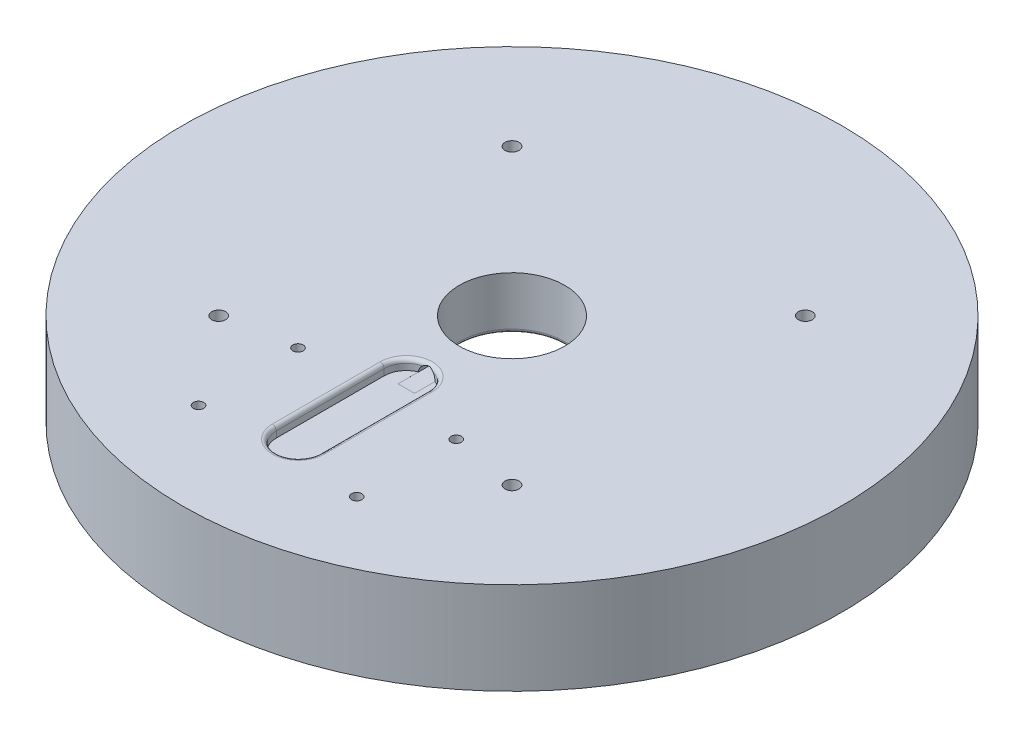
from build123d import *

# Parameters (mm, degrees)
SKETCH1_R               = 154.305
BOSS_EXTRUDE1_DEPTH     = 25.4
SKETCH3_R               = 3.37312
CUT_EXTRUDE1_DEPTH      = 276.403891776
SKETCH5_R               = 25.4
CUT_EXTRUDE2_DEPTH      = 276.403891776
SKETCH6_W               = 159.004
SKETCH6_H               = 159.004
CUT_EXTRUDE3_DEPTH      = 19.05
BOSS_EXTRUDE2_START     = -19.05
SKETCH7_R               = 158.75
SKETCH7_R_2             = 154.305
BOSS_EXTRUDE2_DEPTH     = 44.45
CUT_EXTRUDE4_DEPTH      = 4.9276
CUT_EXTRUDE8_REACH      = 266.23
CUT_EXTRUDE8_END_RADIUS = 25.4
SKETCH11_R              = 2.499995
CUT_EXTRUDE9_DEPTH      = 8.0000094
BOSS_EXTRUDE3_START     = 19.05
SKETCH12_R              = 29.21
SKETCH12_R_2            = 25.4
BOSS_EXTRUDE3_DEPTH     = 19.05
FILLET1_R               = 1.905


with BuildPart() as part:
    # Sketch1 → Boss-Extrude1 (new body)
    with BuildSketch(Plane(origin=(0, 0, 0), x_dir=(1, 0, 0), z_dir=(0, 1, 0))):
        with Locations(Location((0, 0, 0), (0, 0, 270))):
            Circle(SKETCH1_R)
    extrude(amount=BOSS_EXTRUDE1_DEPTH)

    # Sketch3 → Cut-Extrude1 (cut, through all)
    with BuildSketch(Plane(origin=(3.2638069, 0, 70.137007426), x_dir=(-1, 0, 0), z_dir=(0, -1, 0))):
        with Locations(Location((-67.3799431, 140.780757426, 0), (0, 0, 90))):
            Circle(SKETCH3_R)
        with Locations(Location((73.9075569, 140.780757426, 0), (0, 0, 90))):
            Circle(SKETCH3_R)
        with Locations(Location((73.9075569, -0.506742574, 0), (0, 0, 90))):
            Circle(SKETCH3_R)
        with Locations(Location((-67.3799431, -0.506742574, 0), (0, 0, 90))):
            Circle(SKETCH3_R)
    extrude(amount=-CUT_EXTRUDE1_DEPTH, mode=Mode.SUBTRACT)

    # Sketch5 → Cut-Extrude2 (cut, through all)
    with BuildSketch(Plane(origin=(3.2638069, 0, 70.137007426), x_dir=(-1, 0, 0), z_dir=(0, -1, 0))):
        with Locations(Location((3.2638069, 70.137007426, 0), (0, 0, 90))):
            Circle(SKETCH5_R)
    extrude(amount=-CUT_EXTRUDE2_DEPTH, mode=Mode.SUBTRACT)

    # Sketch6 → Cut-Extrude3 (cut)
    with BuildSketch(Plane.XZ):
        Rectangle(SKETCH6_W, SKETCH6_H)
    extrude(amount=-CUT_EXTRUDE3_DEPTH, mode=Mode.SUBTRACT)

    # Sketch7 → Boss-Extrude2 (add)
    with BuildSketch(Plane(origin=(0, 0, 0), x_dir=(1, 0, 0), z_dir=(0, 1, 0)).offset(BOSS_EXTRUDE2_START)):
        with Locations(Location((0, 0, 0), (0, 0, 270))):
            Circle(SKETCH7_R)
        with Locations(Location((0, 0, 0), (0, 0, 270))):
            Circle(SKETCH7_R_2, mode=Mode.SUBTRACT)
    extrude(amount=BOSS_EXTRUDE2_DEPTH)

    # Sketch8 → Cut-Extrude4 (cut)
    with BuildSketch(Plane(origin=(0, 25.4, 0), x_dir=(1, 0, 0), z_dir=(0, 1, 0))):
        with BuildLine():
            Line((-10.642138235, -102.903613136), (-10.642138235, -50.942074053))
            ThreePointArc((-10.642138235, -50.942074053), (0, -40.299935817), (10.642138235, -50.942074053))
            Line((10.642138235, -50.942074053), (10.642138235, -102.903613136))
            ThreePointArc((10.642138235, -102.903613136), (0, -113.545751371), (-10.642138235, -102.903613136))
        make_face()
    extrude(amount=-CUT_EXTRUDE4_DEPTH, mode=Mode.SUBTRACT)

    # Cut-Extrude8: up to this cylinder (the profile starts outside it)
    cut_extrude8_end = Plane(origin=(0, 22.143059, 0), z_dir=(0, -1, 0)) * Cylinder(CUT_EXTRUDE8_END_RADIUS, 584.26, mode=Mode.PRIVATE)
    # Sketch10 → Cut-Extrude8 (cut, up to the surface)
    with BuildSketch(Plane(origin=(0, 0, 50.942074053), x_dir=(-1, 0, 0), z_dir=(0, 0, -1)), mode=Mode.PRIVATE) as cut_extrude8_sk1:
        with BuildLine():
            Line((3.978866006, 20.464038844), (-3.978866006, 20.464038844))
            ThreePointArc((-3.978866006, 20.464038844), (0, 24.421873778), (3.978866006, 20.464038844))
        make_face()
    cut_extrude8_tool1 = extrude(cut_extrude8_sk1.sketch, amount=CUT_EXTRUDE8_REACH, mode=Mode.PRIVATE) - cut_extrude8_end
    add(cut_extrude8_tool1.solids().sort_by_distance((0, 22.143059, 50.942074))[0], mode=Mode.SUBTRACT)

    # Sketch11 → Cut-Extrude9 (cut)
    with BuildSketch(Plane(origin=(0, 25.4, 0), x_dir=(1, 0, 0), z_dir=(0, 1, 0))):
        with Locations(Location((-38.1, -64.976536144, 0), (0, 0, 270))):
            Circle(SKETCH11_R)
        with Locations(Location((38.1, -64.976536144, 0), (0, 0, 270))):
            Circle(SKETCH11_R)
        with Locations(Location((38.1, -112.910719468, 0), (0, 0, 270))):
            Circle(SKETCH11_R)
        with Locations(Location((-38.1, -112.910719468, 0), (0, 0, 270))):
            Circle(SKETCH11_R)
    extrude(amount=-CUT_EXTRUDE9_DEPTH, mode=Mode.SUBTRACT)

    # Sketch12 → Boss-Extrude3 (add)
    with BuildSketch(Plane.XZ.offset(-19.05).offset(BOSS_EXTRUDE3_START)):
        with Locations(Location((0, 0, 0), (0, 0, 90))):
            Circle(SKETCH12_R)
        with Locations(Location((0, 0, 0), (0, 0, 270))):
            Circle(SKETCH12_R_2, mode=Mode.SUBTRACT)
    extrude(amount=-BOSS_EXTRUDE3_DEPTH)

    # Fillet1
    # the kernel refuses this fillet: 1.905 mm, written as the material it adds along each edge
    with BuildSketch(Plane(origin=(0, 19.05, 0), x_dir=(0, 0, 1), z_dir=(1, 0, 0))) as fillet1_piece_1:
        with BuildLine():
            CenterArc((29.21 + FILLET1_R, FILLET1_R), FILLET1_R, 180, 90)
            Line((29.21, FILLET1_R), (29.21, 0))
            Line((29.21, 0), (29.21 + FILLET1_R, 0))
        make_face()
    revolve(axis=Axis((0, 19.05, 0), (0, -1, 0)))
    # the kernel refuses this fillet: 1.905 mm, written as the material it takes off along each edge
    with BuildSketch(Plane(origin=(0, 0, 0), x_dir=(0, 0, -1), z_dir=(-1, 0, 0))) as fillet1_2_piece_1:
        with BuildLine():
            CenterArc((25.4 + FILLET1_R, -FILLET1_R), FILLET1_R, 90, 90)
            Line((25.4 + FILLET1_R, 0), (25.4, 0))
            Line((25.4, 0), (25.4, -FILLET1_R))
        make_face()
    revolve(axis=Axis((0, 0, 0), (0, -1, 0)), mode=Mode.SUBTRACT)
    with BuildSketch(Plane(origin=(-10.642138235, 25.4, 102.903613136), x_dir=(-1, 0, 0), z_dir=(0, 0, -1)), Plane(origin=(10.642138235, 25.4, 50.942074053), x_dir=(1, 0, 0), z_dir=(0, 0, 1))) as fillet1_2_piece_2:
        with BuildLine():
            CenterArc((FILLET1_R, -FILLET1_R), FILLET1_R, 90, 90)
            Line((0, -FILLET1_R), (0, 0))
            Line((0, 0), (FILLET1_R, 0))
        make_face()
    extrude(amount=51.961539084, mode=Mode.SUBTRACT)
    with BuildSketch(Plane(origin=(0, 25.4, 102.903613136), x_dir=(1, 0, 0), z_dir=(0, 0, -1))) as fillet1_2_piece_3:
        with BuildLine():
            CenterArc((10.642138235 + FILLET1_R, FILLET1_R), FILLET1_R, 180, 90)
            Line((10.642138235, FILLET1_R), (10.642138235, 0))
            Line((10.642138235, 0), (10.642138235 + FILLET1_R, 0))
        make_face()
    revolve(axis=Axis((0, 25.4, 102.903613136), (0, -1, 0)), revolution_arc=180, mode=Mode.SUBTRACT)
    with BuildSketch(Plane(origin=(0, 25.4, 50.942074053), x_dir=(-1, 0, 0), z_dir=(0, 0, 1))) as fillet1_2_piece_4:
        with BuildLine():
            CenterArc((10.642138235 + FILLET1_R, FILLET1_R), FILLET1_R, 180, 90)
            Line((10.642138235, FILLET1_R), (10.642138235, 0))
            Line((10.642138235, 0), (10.642138235 + FILLET1_R, 0))
        make_face()
    revolve(axis=Axis((0, 25.4, 50.942074053), (0, -1, 0)), revolution_arc=180, mode=Mode.SUBTRACT)
    with BuildSketch(Plane(origin=(0, 20.464038844, 0), x_dir=(0.33800763161773084, 0, 0.9411433689763598), z_dir=(0.9411433689763598, 0, -0.33800763161773084))) as fillet1_2_piece_5_section:
        with BuildLine():
            CenterArc((25.4 + FILLET1_R, FILLET1_R), FILLET1_R, 180, 90)
            Line((25.4 + FILLET1_R, 0), (25.4, 0))
            Line((25.4, 0), (25.4, FILLET1_R))
        make_face()
    fillet1_2_piece_5 = revolve(axis=Axis((0, 20.464038844, 0), (0, -1, 0)), revolution_arc=39.511069251, mode=Mode.PRIVATE)
    fillet1_2_piece_5 = fillet1_2_piece_5 & Plane(origin=(0, 20.442951895, 25.734088131), x_dir=(0.9999859566813862, 0.0052996641415057515, 0), z_dir=(0, 0, 1)) * Cylinder(3.978921884, 110, mode=Mode.PRIVATE)
    add(fillet1_2_piece_5, mode=Mode.SUBTRACT)


solid = part.part
